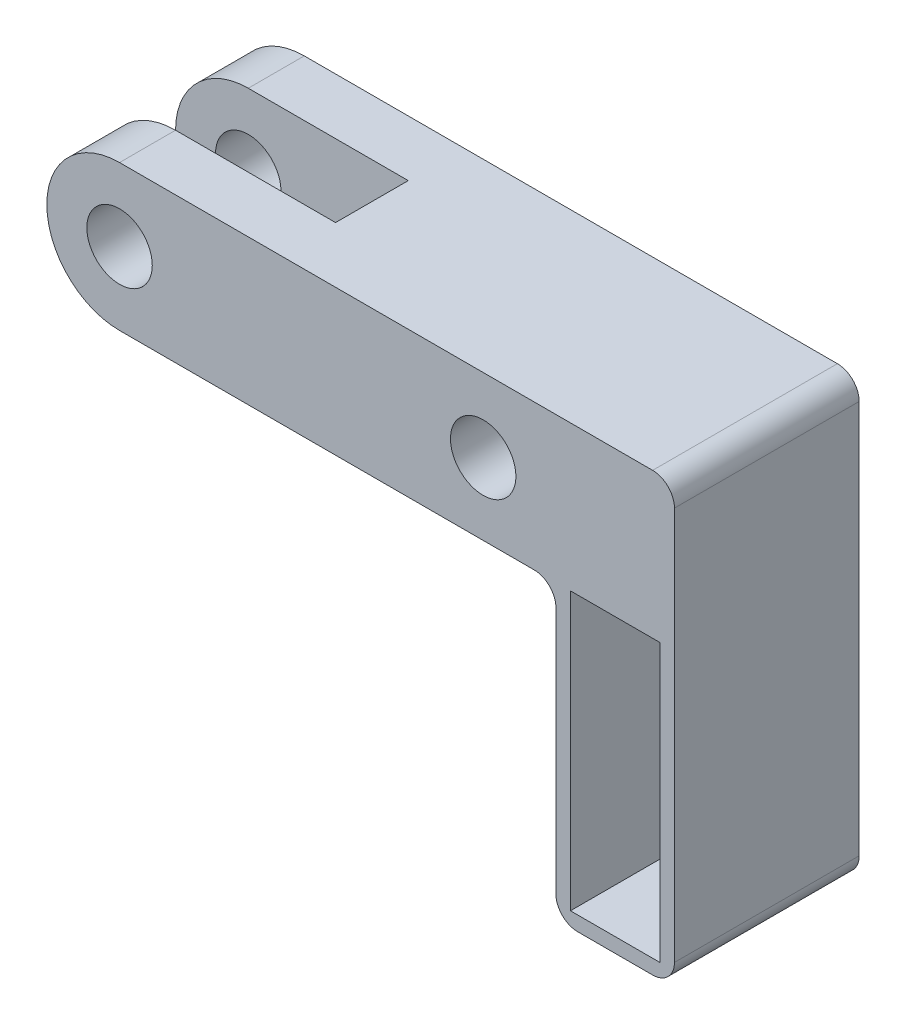
from build123d import *

# Parameters (mm, degrees)
SKETCH1_R           = 2.25
SKETCH1_W           = 6.15
SKETCH1_H           = 19.05
BOSS_EXTRUDE1_DEPTH = 6.35
SKETCH13_W          = 16
SKETCH13_H          = 5
CUT_EXTRUDE1_DEPTH  = 10
CHAMFER1_SIZE2      = 10
CHAMFER1_SIZE       = 8
FILLET1_R           = 1.5


with BuildPart() as part:
    # Sketch1 → Boss-Extrude1 (new, symmetric)
    with BuildSketch(Plane.XY):
        with BuildLine():
            Line((0, -5), (30, -5))
            Line((30, -5), (30, -25.05))
            Line((30, -25.05), (38.15, -25.05))
            Line((38.15, -25.05), (38.15, 5))
            Line((38.15, 5), (0, 5))
            ThreePointArc((0, 5), (-5, 0), (0, -5))
        make_face()
        Circle(SKETCH1_R, mode=Mode.SUBTRACT)
        with Locations((25, -0.066795827)):
            Circle(SKETCH1_R, mode=Mode.SUBTRACT)
        with Locations((34.075, -14.525)):
            Rectangle(SKETCH1_W, SKETCH1_H, mode=Mode.SUBTRACT)
    extrude(amount=BOSS_EXTRUDE1_DEPTH, both=True)

    # Sketch13 → Cut-Extrude1 (cut)
    with BuildSketch(Plane.XZ.offset(5)):
        with Locations((3, 0)):
            Rectangle(SKETCH13_W, SKETCH13_H)
    extrude(amount=-CUT_EXTRUDE1_DEPTH, mode=Mode.SUBTRACT)

    # Chamfer1
    chamfer1_edges = [part.edges().sort_by_distance(p)[0] for p in [
        (11, -5, 0),
    ]]
    chamfer1_side = [part.faces().sort_by_distance(p)[0] for p in [
        (11.16, -5, 0),
    ]]
    chamfer(chamfer1_edges, length=CHAMFER1_SIZE - 0.0001, length2=CHAMFER1_SIZE2 - 0.0001, reference=chamfer1_side[0])  # a hair under: the kernel refuses the full size

    # Fillet1
    fillet1_edges = [part.edges().sort_by_distance(p)[0] for p in [
        (38.15, 5, 0),
        (38.15, -25.05, 0),
        (30, -25.05, 0),
        (30, -5, 0),
    ]]
    fillet(fillet1_edges, radius=FILLET1_R)


solid = part.part
